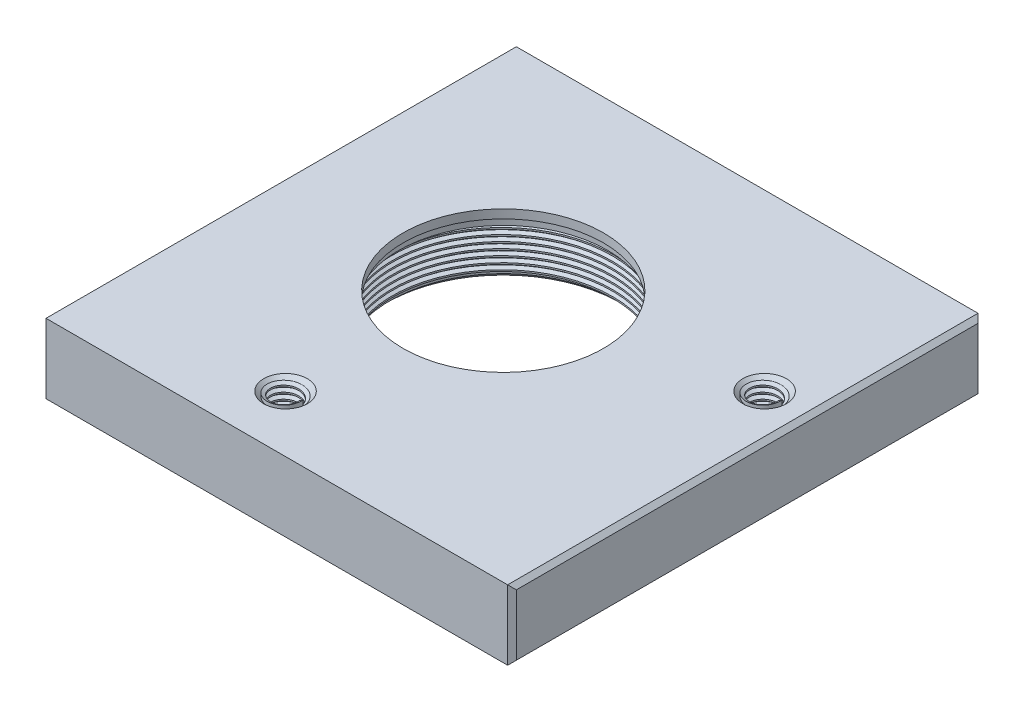
from build123d import *
from build123d.topology import SkipClean

# Parameters (mm, degrees)
SKETCH_1_W          = 54
SKETCH_1_H          = 54
SKETCH_1_R          = 11.5
SKETCH_1_R_2        = 2
EXTRUDE_1_DEPTH     = 8
CHAMFER_1_SIZE      = 0.5
SKETCH_2_R          = 13
CUT_EXTRUDE_1_DEPTH = 6
SKETCH_3_R          = 12
CUT_EXTRUDE_2_DEPTH = 1
CHAMFER_2_SIZE      = 0.5
THREAD_1_PITCH      = 0.7
THREAD_2_PITCH      = 0.7
THREAD_3_PITCH      = 0.7


with BuildPart() as part:
    # Sketch 1 → Бобышка-Вытянуть1 (new body)
    with BuildSketch(Plane(origin=(0, 0, 0), x_dir=(1, 0, 0), z_dir=(0, 1, 0))):
        with Locations((1.81097561, 3.375)):
            Rectangle(SKETCH_1_W, SKETCH_1_H)
        with Locations(Location((-1.18902439, 5.375, 0), (0, 0, 270))):
            Circle(SKETCH_1_R, mode=Mode.SUBTRACT)
        with Locations(Location((23.81097561, 10.375, 0), (0, 0, 270))):
            Circle(SKETCH_1_R_2, mode=Mode.SUBTRACT)
        with Locations(Location((-3.68902439, -17.125, 0), (0, 0, 270))):
            Circle(SKETCH_1_R_2, mode=Mode.SUBTRACT)
    extrude(amount=EXTRUDE_1_DEPTH)

    # Фаска1
    chamfer_1_edges = [part.edges().sort_by_distance(p)[0] for p in [
        (28.81097561, 8, -3.375),
        (23.81097561, 0, -12.375),
        (23.81097561, 8, -12.375),
        (-3.68902439, 0, 15.125),
        (-3.68902439, 8, 15.125),
        (-25.18902439, 8, -3.375),
        (28.81097561, 0, -3.375),
        (-25.18902439, 0, -3.375),
        (-25.18902439, 4, -30.375),
        (28.81097561, 4, -30.375),
        (28.81097561, 4, 23.625),
        (-25.18902439, 4, 23.625),
    ]]
    chamfer(chamfer_1_edges, length=CHAMFER_1_SIZE)

    # Sketch 2 → Вырез-Вытянуть1 (cut)
    with BuildSketch(Plane.XZ):
        with Locations(Location((-1.18902439, -5.375, 0), (0, 0, 270))):
            Circle(SKETCH_2_R)
    extrude(amount=-CUT_EXTRUDE_1_DEPTH, mode=Mode.SUBTRACT)

    # Sketch 3 → Вырез-Вытянуть2 (cut)
    with BuildSketch(Plane.XZ.offset(-6)):
        with Locations(Location((-1.18902439, -5.375, 0), (0, 0, 270))):
            Circle(SKETCH_3_R)
    extrude(amount=-CUT_EXTRUDE_2_DEPTH, mode=Mode.SUBTRACT)

    # Фаска2
    chamfer_2_edges = [part.edges().sort_by_distance(p)[0] for p in [
        (-1.18902439, 0, 7.625),
    ]]
    chamfer(chamfer_2_edges, length=CHAMFER_2_SIZE)

    # Резьба1: the profile of Sketch 1 2 profile screwed along a right-hand helix of 8.571429 turns, 6 arcs to a turn; built about Z, then put on its axis
    with SkipClean():  # the faces are left unmerged after this step: merging them gives an invalid solid
        thread_1_z = Axis((0, 0, 0), (0, 0, 1))
        thread_1_corners = [(13.0003, 0, -0.000173205), (13.0003, 0, 0.612673203), (12.621113887, 0, 0.393749999), (12.621113887, 0, 0.218749999)]
        with BuildLine(mode=Mode.PRIVATE) as thread_1_profile:
            Line(thread_1_corners[0], thread_1_corners[1])
            Line(thread_1_corners[1], thread_1_corners[2])
            Line(thread_1_corners[2], thread_1_corners[3])
            Line(thread_1_corners[3], thread_1_corners[0])
        thread_1_cap = Face(thread_1_profile.wire())
        thread_1_turn_angles = [0, 30, 60, 90, 120, 150, 180, 210, 240, 270, 300, 330, 360]
        thread_1_turn_weights = [1, 0.8660254037844387, 1, 0.8660254037844387, 1, 0.8660254037844387, 1, 0.8660254037844387, 1, 0.8660254037844387, 1, 0.8660254037844387, 1]
        thread_1_turn_rails = [Edge.make_bspline([Vector(p[0], p[1], 0).rotate(thread_1_z, thread_1_turn_angles[k]) / thread_1_turn_weights[k] + Vector(0, 0, p[2] + THREAD_1_PITCH * thread_1_turn_angles[k] / 360) for k in range(13)], [0, 0, 0, 1, 1, 2, 2, 3, 3, 4, 4, 5, 5, 6, 6, 6], 2, thread_1_turn_weights) for p in thread_1_corners]
        thread_1_turn_sides = [Face.make_surface_from_curves(thread_1_turn_rails[p[0]], thread_1_turn_rails[p[1]]) for p in [(0, 1), (1, 2), (2, 3), (3, 0)]]
        thread_1_last_angles = [2880, 2910, 2940, 2970, 3000, 3030, 3060, 3072.857142857, 3085.714285714]
        thread_1_last_weights = [1, 0.8660254037844387, 1, 0.8660254037844387, 1, 0.8660254037844387, 1, 0.9749279121818235, 1]
        thread_1_last_rails = [Edge.make_bspline([Vector(p[0], p[1], 0).rotate(thread_1_z, thread_1_last_angles[k]) / thread_1_last_weights[k] + Vector(0, 0, p[2] + THREAD_1_PITCH * thread_1_last_angles[k] / 360) for k in range(9)], [0, 0, 0, 1, 1, 2, 2, 3, 3, 4, 4, 4], 2, thread_1_last_weights) for p in thread_1_corners]
        thread_1_last_sides = [Face.make_surface_from_curves(thread_1_last_rails[p[0]], thread_1_last_rails[p[1]]) for p in [(0, 1), (1, 2), (2, 3), (3, 0)]]
        thread_1 = Plane(origin=(-1.18902439, 0.5, -5.375), x_dir=(1, 0, 0), z_dir=(0, 1, 0)) * Solid(Shell([*[p.moved(Location((0, 0, THREAD_1_PITCH * i))) for i in range(8) for p in thread_1_turn_sides], *thread_1_last_sides, thread_1_cap, thread_1_cap.rotate(thread_1_z, 3085.714285714).moved(Location((0, 0, THREAD_1_PITCH * 3085.714285714 / 360)))]))
        add(thread_1)

    # Резьба2: the profile of Sketch 2 2 profile screwed along a right-hand helix of 10 turns, 6 arcs to a turn; built about Z, then put on its axis
    with SkipClean():  # the faces are left unmerged after this step: merging them gives an invalid solid
        thread_2_z = Axis((0, 0, 0), (0, 0, 1))
        thread_2_corners = [(2.0003, 0, -0.000173205), (2.0003, 0, 0.612673203), (1.621113887, 0, 0.393749999), (1.621113887, 0, 0.218749999)]
        with BuildLine(mode=Mode.PRIVATE) as thread_2_profile:
            Line(thread_2_corners[0], thread_2_corners[1])
            Line(thread_2_corners[1], thread_2_corners[2])
            Line(thread_2_corners[2], thread_2_corners[3])
            Line(thread_2_corners[3], thread_2_corners[0])
        thread_2_cap = Face(thread_2_profile.wire())
        thread_2_turn_angles = [0, 30, 60, 90, 120, 150, 180, 210, 240, 270, 300, 330, 360]
        thread_2_turn_weights = [1, 0.8660254037844387, 1, 0.8660254037844387, 1, 0.8660254037844387, 1, 0.8660254037844387, 1, 0.8660254037844387, 1, 0.8660254037844387, 1]
        thread_2_turn_rails = [Edge.make_bspline([Vector(p[0], p[1], 0).rotate(thread_2_z, thread_2_turn_angles[k]) / thread_2_turn_weights[k] + Vector(0, 0, p[2] + THREAD_2_PITCH * thread_2_turn_angles[k] / 360) for k in range(13)], [0, 0, 0, 1, 1, 2, 2, 3, 3, 4, 4, 5, 5, 6, 6, 6], 2, thread_2_turn_weights) for p in thread_2_corners]
        thread_2_turn_sides = [Face.make_surface_from_curves(thread_2_turn_rails[p[0]], thread_2_turn_rails[p[1]]) for p in [(0, 1), (1, 2), (2, 3), (3, 0)]]
        thread_2 = Plane(origin=(-3.68902439, 0.5, 17.125), x_dir=(1, 0, 0), z_dir=(0, 1, 0)) * Solid(Shell([*[p.moved(Location((0, 0, THREAD_2_PITCH * i))) for i in range(10) for p in thread_2_turn_sides], thread_2_cap, thread_2_cap.rotate(thread_2_z, 3600).moved(Location((0, 0, THREAD_2_PITCH * 3600 / 360)))]))
        add(thread_2)

    # Резьба3: the profile of Sketch 3 2 profile screwed along a right-hand helix of 10 turns, 6 arcs to a turn; built about Z, then put on its axis
    with SkipClean():  # the faces are left unmerged after this step: merging them gives an invalid solid
        thread_3_z = Axis((0, 0, 0), (0, 0, 1))
        thread_3_corners = [(2.0003, 0, -0.000173205), (2.0003, 0, 0.612673203), (1.621113887, 0, 0.393749999), (1.621113887, 0, 0.218749999)]
        with BuildLine(mode=Mode.PRIVATE) as thread_3_profile:
            Line(thread_3_corners[0], thread_3_corners[1])
            Line(thread_3_corners[1], thread_3_corners[2])
            Line(thread_3_corners[2], thread_3_corners[3])
            Line(thread_3_corners[3], thread_3_corners[0])
        thread_3_cap = Face(thread_3_profile.wire())
        thread_3_turn_angles = [0, 30, 60, 90, 120, 150, 180, 210, 240, 270, 300, 330, 360]
        thread_3_turn_weights = [1, 0.8660254037844387, 1, 0.8660254037844387, 1, 0.8660254037844387, 1, 0.8660254037844387, 1, 0.8660254037844387, 1, 0.8660254037844387, 1]
        thread_3_turn_rails = [Edge.make_bspline([Vector(p[0], p[1], 0).rotate(thread_3_z, thread_3_turn_angles[k]) / thread_3_turn_weights[k] + Vector(0, 0, p[2] + THREAD_3_PITCH * thread_3_turn_angles[k] / 360) for k in range(13)], [0, 0, 0, 1, 1, 2, 2, 3, 3, 4, 4, 5, 5, 6, 6, 6], 2, thread_3_turn_weights) for p in thread_3_corners]
        thread_3_turn_sides = [Face.make_surface_from_curves(thread_3_turn_rails[p[0]], thread_3_turn_rails[p[1]]) for p in [(0, 1), (1, 2), (2, 3), (3, 0)]]
        thread_3 = Plane(origin=(23.81097561, 0.5, -10.375), x_dir=(1, 0, 0), z_dir=(0, 1, 0)) * Solid(Shell([*[p.moved(Location((0, 0, THREAD_3_PITCH * i))) for i in range(10) for p in thread_3_turn_sides], thread_3_cap, thread_3_cap.rotate(thread_3_z, 3600).moved(Location((0, 0, THREAD_3_PITCH * 3600 / 360)))]))
        add(thread_3)


solid = part.part
